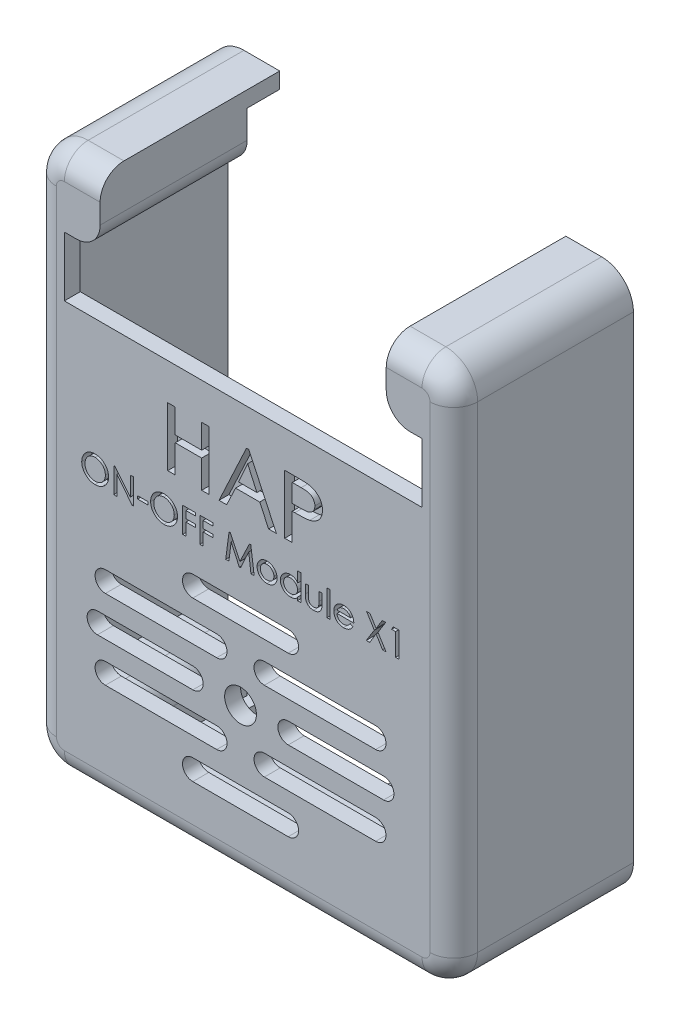
from build123d import *

# Parameters (mm, degrees)
ESBO_O1_W                = 53
ESBO_O1_H                = 68
RESSALTO_EXTRUS_O1_DEPTH = 22.6
FILETE1_R                = 4
FILETE2_R                = 3
CASCA1_T                 = -2
RESSALTO_EXTRUS_O2_DEPTH = 16.5
ESBO_O4_R                = 1
CORTE_EXTRUS_O1_DEPTH    = 6
CORTE_EXTRUS_O2_DEPTH    = 49.672476822
ESBO_O6_W                = 17
ESBO_O6_H                = 2
CORTE_EXTRUS_O3_DEPTH    = 6
RESSALTO_EXTRUS_O3_DEPTH = 4.5
ESBO_O8_W                = 21
ESBO_O8_H                = 8
RESSALTO_EXTRUS_O4_DEPTH = 1.5
FILETE3_R                = 1
ESBO_O11_W               = 1.302564103
ESBO_O11_H               = 0.366346154
ESBO_O11_W_2             = 0.407051282
ESBO_O11_H_2             = 3.256410256
CORTE_EXTRUS_O5_DEPTH    = 1.25
ESBO_O15_R               = 2
CORTE_EXTRUS_O6_DEPTH    = 54.037816697
CORTE_EXTRUS_O7_DEPTH    = 54.037816697
CORTE_EXTRUS_O8_DEPTH    = 54.037816697


with BuildPart() as part:
    # Esboço1 → Ressalto-extrusão1 (new body)
    with BuildSketch(Plane.XY):
        Rectangle(ESBO_O1_W, ESBO_O1_H)
    extrude(amount=RESSALTO_EXTRUS_O1_DEPTH)

    # Filete1
    filete1_edges = [part.edges().sort_by_distance(p)[0] for p in [
        (-26.5, -34, 11.3),
        (26.5, -34, 11.3),
        (-26.5, 34, 11.3),
        (26.5, 34, 11.3),
    ]]
    fillet(filete1_edges, radius=FILETE1_R)

    # Filete2
    filete2_edges = [part.edges().sort_by_distance(p)[0] for p in [
        (0, 34, 22.6),
        (26.5, 0, 22.6),
        (25.328427125, -32.828427125, 22.6),
        (0, -34, 22.6),
        (-25.328427125, -32.828427125, 22.6),
        (-26.5, 0, 22.6),
        (-25.328427125, 32.828427125, 22.6),
        (25.328427125, 32.828427125, 22.6),
    ]]
    fillet(filete2_edges, radius=FILETE2_R)

    # Casca1
    casca1_openings = [part.faces().sort_by_distance(p)[0] for p in [
        (0, 0, 0),
    ]]
    offset(amount=CASCA1_T, openings=casca1_openings, kind=Kind.INTERSECTION)

    # Esboço3 → Ressalto-extrusão2 (add)
    with BuildSketch(Plane(origin=(0, 0, 20.6), x_dir=(-1, 0, 0), z_dir=(0, 0, -1))):
        with BuildLine():
            Line((-18, -28.5), (-18, -32))
            Line((-18, -32), (-22.5, -32))
            ThreePointArc((-22.5, -32), (-23.914213562, -31.414213562), (-24.5, -30))
            Line((-24.5, -30), (-24.5, -25.5))
            Line((-24.5, -25.5), (-21, -25.5))
            ThreePointArc((-21, -25.5), (-18.878679656, -26.378679656), (-18, -28.5))
        make_face()
        with BuildLine():
            Line((22.5, -32), (18, -32))
            Line((18, -32), (18, -28.5))
            ThreePointArc((18, -28.5), (18.878679656, -26.378679656), (21, -25.5))
            Line((21, -25.5), (24.5, -25.5))
            Line((24.5, -25.5), (24.5, -30))
            ThreePointArc((24.5, -30), (23.914213562, -31.414213562), (22.5, -32))
        make_face()
        with BuildLine():
            Line((18, 28.5), (18, 32))
            Line((18, 32), (22.5, 32))
            ThreePointArc((22.5, 32), (23.914213562, 31.414213562), (24.5, 30))
            Line((24.5, 30), (24.5, 25.5))
            Line((24.5, 25.5), (21, 25.5))
            ThreePointArc((21, 25.5), (18.878679656, 26.378679656), (18, 28.5))
        make_face()
        with BuildLine():
            Line((-22.5, 32), (-18, 32))
            Line((-18, 32), (-18, 28.5))
            ThreePointArc((-18, 28.5), (-18.878679656, 26.378679656), (-21, 25.5))
            Line((-21, 25.5), (-24.5, 25.5))
            Line((-24.5, 25.5), (-24.5, 30))
            ThreePointArc((-24.5, 30), (-23.914213562, 31.414213562), (-22.5, 32))
        make_face()
    extrude(amount=RESSALTO_EXTRUS_O2_DEPTH)

    # Esboço4 → Corte-extrusão1 (cut)
    with BuildSketch(Plane(origin=(0, 0, 4.1), x_dir=(-1, 0, 0), z_dir=(0, 0, -1))):
        with Locations((-21, -28.5)):
            Circle(ESBO_O4_R)
        with Locations((21, -28.5)):
            Circle(ESBO_O4_R)
        with Locations((-21, 28.5)):
            Circle(ESBO_O4_R)
        with Locations((21, 28.5)):
            Circle(ESBO_O4_R)
    extrude(amount=-CORTE_EXTRUS_O1_DEPTH, mode=Mode.SUBTRACT)

    # Esboço5 → Corte-extrusão2 (cut, through all)
    with BuildSketch(Plane.XY.offset(22.6)):
        with BuildLine():
            Line((-18, 34), (18, 34))
            Line((18, 34), (18, 28.5))
            ThreePointArc((18, 28.5), (18.878679656, 26.378679656), (21, 25.5))
            Line((21, 25.5), (22.5, 25.5))
            Line((22.5, 25.5), (22.5, 18))
            Line((22.5, 18), (-22.5, 18))
            Line((-22.5, 18), (-22.5, 25.5))
            Line((-22.5, 25.5), (-21, 25.5))
            ThreePointArc((-21, 25.5), (-18.878679656, 26.378679656), (-18, 28.5))
            Line((-18, 28.5), (-18, 34))
        make_face()
    extrude(amount=-CORTE_EXTRUS_O2_DEPTH, mode=Mode.SUBTRACT)

    # Esboço6 → Corte-extrusão3 (cut)
    with BuildSketch(Plane(origin=(0, 0, 0), x_dir=(-1, 0, 0), z_dir=(0, 0, -1))):
        with Locations((8, -33)):
            Rectangle(ESBO_O6_W, ESBO_O6_H)
    extrude(amount=-CORTE_EXTRUS_O3_DEPTH, mode=Mode.SUBTRACT)

    # Esboço7 → Ressalto-extrusão3 (add)
    with BuildSketch(Plane.XZ.offset(34)):
        Polygon((-16.5, 0), (-18.5, 0), (-18.5, 8), (2.5, 8), (2.5, 0), (0.5, 0), (0.5, 6), (-16.5, 6), align=None)
    extrude(amount=RESSALTO_EXTRUS_O3_DEPTH)

    # Esboço8 → Ressalto-extrusão4 (add)
    with BuildSketch(Plane.XZ.offset(38.5)):
        with Locations((-8, 4)):
            Rectangle(ESBO_O8_W, ESBO_O8_H)
    extrude(amount=RESSALTO_EXTRUS_O4_DEPTH)

    # Filete3
    filete3_edges = [part.edges().sort_by_distance(p)[0] for p in [
        (-18.5, -37, 8),
        (-8, -40, 8),
        (2.5, -37, 8),
        (2.5, -34, 4),
        (-18.5, -34, 4),
        (-8, -34, 8),
        (2.5, -40, 4),
        (-18.5, -40, 4),
    ]]
    fillet(filete3_edges, radius=FILETE3_R)

    # Esboço11 → Corte-extrusão5 (cut)
    # profile 1 of 17: a face of its own
    with BuildSketch(Plane.XY.offset(22.6)):
        Polygon((-9.497863248, 13.408333333), (-8.548076923, 13.408333333), (-8.548076923, 10.369017094), (-5.223824786, 10.369017094), (-5.223824786, 13.408333333), (-4.274038462, 13.408333333), (-4.274038462, 6), (-5.223824786, 6), (-5.223824786, 9.514209402), (-8.548076923, 9.514209402), (-8.548076923, 6), (-9.497863248, 6), align=None)
    # profile 2 of 17: a face of its own
    with BuildSketch(Plane.XY.offset(22.6)):
        Polygon((0.712339744, 13.408333333), (4.179059829, 6), (3.204044805, 6), (2.079141627, 8.374465812), (-0.951270366, 8.374465812), (-2.076173544, 6), (-3.039316239, 6), (0.415531517, 13.408333333), align=None)
        Polygon((0.56393563, 11.789244458), (-0.58916433, 9.229273504), (1.728907919, 9.229273504), align=None, mode=Mode.SUBTRACT)
    # profile 3 of 17: a face of its own
    with BuildSketch(Plane.XY.offset(22.6)):
        with BuildLine():
            Line((5.223824786, 13.408333333), (6.741998865, 13.408333333))
            add(Edge.make_bspline(
                [(6.741998865, 13.408333333), (6.842424822, 13.408278623), (7.034886838, 13.408173773), (7.310897954, 13.401068802), (7.561302187, 13.394936623), (7.786469526, 13.383150051), (7.985887317, 13.367004707), (8.159627149, 13.348019716), (8.307875568, 13.326666846), (8.397280983, 13.307362149), (8.438257879, 13.29851429)],
                knots=[0, 0, 0, 0, 1.415450773, 2.712650385, 3.891531898, 4.945867971, 5.890285756, 6.71109784, 7.409261617, 8, 8, 8, 8], degree=3))
            add(Edge.make_bspline(
                [(8.438257879, 13.29851429), (8.495942574, 13.283680344), (8.609736796, 13.254417517), (8.772409869, 13.194098175), (8.926764641, 13.125557678), (9.072274115, 13.047590545), (9.207451971, 12.957542686), (9.335214601, 12.859707097), (9.451632221, 12.749135392), (9.560693201, 12.63119165), (9.656383934, 12.503181942), (9.742123106, 12.36943773), (9.81318784, 12.228016417), (9.871591028, 12.079444043), (9.917246912, 11.924495232), (9.950087848, 11.762676295), (9.969821611, 11.594342074), (9.971766058, 11.479628522), (9.97275641, 11.421202257)],
                knots=[0, 0, 0, 0, 1.085641105, 2.141637125, 3.15936318, 4.164535163, 5.147931294, 6.118832473, 7.09541784, 8.072503165, 9.045079613, 10.006206652, 10.966486436, 11.926469503, 12.914201526, 13.908586125, 14.934794539, 16, 16, 16, 16], degree=3))
            add(Edge.make_bspline(
                [(9.97275641, 11.421202257), (9.971744331, 11.362778714), (9.969748707, 11.24757889), (9.950139559, 11.078238345), (9.917268861, 10.916083249), (9.872953033, 10.760397252), (9.814712204, 10.612148591), (9.745119235, 10.470085699), (9.66099468, 10.335818116), (9.564956582, 10.208413881), (9.456502164, 10.089830924), (9.33720323, 9.980519339), (9.205491635, 9.882388209), (9.062718232, 9.793676181), (8.909380518, 9.712827643), (8.743935903, 9.643289027), (8.567122515, 9.584035503), (8.444410034, 9.552528781), (8.381864316, 9.536470019)],
                knots=[0, 0, 0, 0, 1.042501879, 2.055610221, 3.037454288, 3.993184118, 4.940927036, 5.876790881, 6.812738028, 7.76458517, 8.720845088, 9.677105007, 10.648370915, 11.647960469, 12.67482723, 13.739162042, 14.847666245, 16, 16, 16, 16], degree=3))
            add(Edge.make_bspline(
                [(8.381864316, 9.536470019), (8.335960628, 9.526517768), (8.235822679, 9.50480714), (8.069649778, 9.482215677), (7.876024426, 9.463707416), (7.65433466, 9.447604886), (7.405489181, 9.434078617), (7.128384218, 9.426026753), (6.823651765, 9.419529496), (6.610912827, 9.41933308), (6.50010016, 9.419230769)],
                knots=[0, 0, 0, 0, 0.596754895, 1.30180848, 2.129432098, 3.068723067, 4.126429569, 5.296393252, 6.591729958, 8, 8, 8, 8], degree=3))
            Line((6.50010016, 9.419230769), (6.173611111, 9.419230769))
            Line((6.173611111, 9.419230769), (6.173611111, 6))
            Line((6.173611111, 6), (5.223824786, 6))
            Line((5.223824786, 6), (5.223824786, 13.408333333))
        make_face()
        with BuildLine():
            Line((6.173611111, 12.553525641), (6.173611111, 10.271070379))
            Line((6.173611111, 10.271070379), (7.242120726, 10.25919805))
            add(Edge.make_bspline(
                [(7.242120726, 10.25919805), (7.302473989, 10.259993888), (7.418755721, 10.261527217), (7.586559348, 10.266851114), (7.740903047, 10.277671577), (7.882084959, 10.290291281), (8.01039029, 10.307984164), (8.125241418, 10.33006574), (8.227617647, 10.354875585), (8.344686321, 10.393882154), (8.475726415, 10.454787823), (8.61503635, 10.547717277), (8.737833254, 10.658854056), (8.839244978, 10.789661827), (8.920856934, 10.933786251), (8.98152116, 11.087828654), (9.015858204, 11.251503707), (9.020579374, 11.36317167), (9.022970085, 11.419718216)],
                knots=[0, 0, 0, 0, 1.196816259, 2.305888068, 3.328295896, 4.264290022, 5.116006351, 5.89509982, 6.582615619, 7.202969204, 8.339503699, 9.435837163, 10.511976311, 11.608836183, 12.702577786, 13.786378287, 14.879063815, 16, 16, 16, 16], degree=3))
            add(Edge.make_bspline(
                [(9.022970085, 11.419718216), (9.020562105, 11.474291432), (9.015785966, 11.582535354), (8.981269433, 11.741734618), (8.920577209, 11.89274005), (8.838832324, 12.03483991), (8.739496932, 12.164721312), (8.621829434, 12.276451432), (8.488662399, 12.367766063), (8.364340726, 12.426251471), (8.253488827, 12.464312692), (8.155788815, 12.486671003), (8.045417653, 12.507575713), (7.921689966, 12.52549693), (7.784490646, 12.538422006), (7.633985082, 12.546712743), (7.470718887, 12.553209836), (7.357388702, 12.553417672), (7.29851429, 12.553525641)],
                knots=[0, 0, 0, 0, 1.113934591, 2.209447376, 3.306634974, 4.424089692, 5.547326231, 6.633252657, 7.723023745, 8.829884498, 9.427152571, 10.113060991, 10.873719268, 11.720735618, 12.664423995, 13.686322671, 14.798057257, 16, 16, 16, 16], degree=3))
            Line((7.29851429, 12.553525641), (6.173611111, 12.553525641))
        make_face(mode=Mode.SUBTRACT)
    # profile 4 of 17: a face of its own
    with BuildSketch(Plane.XY.offset(22.6)):
        with BuildLine():
            add(Edge.make_bspline(
                [(-18.662665264, 3.256410256), (-18.601744117, 3.255003803), (-18.482002384, 3.25223939), (-18.306342018, 3.228669906), (-18.138591903, 3.19096362), (-17.97899947, 3.137105594), (-17.827456977, 3.068097153), (-17.683725345, 2.983805674), (-17.548231396, 2.883975806), (-17.422631712, 2.769887276), (-17.308539955, 2.645610402), (-17.20743021, 2.514241641), (-17.123469959, 2.37519935), (-17.053283392, 2.230495554), (-17.000175872, 2.078787824), (-16.96082889, 1.921361518), (-16.937623022, 1.757161996), (-16.934777204, 1.645450591), (-16.933333333, 1.588772035)],
                knots=[0, 0, 0, 0, 1.090651108, 2.14369656, 3.167927427, 4.165692988, 5.154576575, 6.145033357, 7.14440862, 8.163220312, 9.178978109, 10.162394332, 11.12677451, 12.082874982, 13.037579715, 13.999894772, 14.985214855, 16, 16, 16, 16], degree=3))
            add(Edge.make_bspline(
                [(-16.933333333, 1.588772035), (-16.934749442, 1.532510339), (-16.937540326, 1.42162915), (-16.961192075, 1.2584302), (-16.999322574, 1.101194651), (-17.052721478, 0.949616309), (-17.122770743, 0.80485136), (-17.20715091, 0.665685237), (-17.307652338, 0.533447238), (-17.421318353, 0.408300417), (-17.546229622, 0.293802288), (-17.680351207, 0.193247278), (-17.822056211, 0.10861202), (-17.970638705, 0.038157045), (-18.127314155, -0.014738461), (-18.290912715, -0.053962692), (-18.462078359, -0.077137407), (-18.578640865, -0.079970765), (-18.637860577, -0.081410256)],
                knots=[0, 0, 0, 0, 1.015667565, 2.001689161, 2.971180881, 3.933912672, 4.898051938, 5.870540525, 6.8683264, 7.892867857, 8.919988739, 9.923897136, 10.914753654, 11.896185405, 12.887840524, 13.895451133, 14.930781579, 16, 16, 16, 16], degree=3))
            add(Edge.make_bspline(
                [(-18.637860577, -0.081410256), (-18.695608506, -0.08001429), (-18.809239239, -0.077267443), (-18.975937346, -0.053473597), (-19.135870235, -0.016380647), (-19.288831264, 0.036928962), (-19.435063394, 0.104924402), (-19.573733498, 0.189271151), (-19.706066842, 0.287509193), (-19.829546275, 0.400049536), (-19.942238019, 0.523287882), (-20.041085816, 0.654470412), (-20.125156425, 0.791928327), (-20.193546393, 0.93581885), (-20.246824366, 1.086278638), (-20.283783736, 1.243271526), (-20.307710291, 1.406350047), (-20.310462493, 1.517240975), (-20.311858974, 1.573507612)],
                knots=[0, 0, 0, 0, 1.056734814, 2.079339537, 3.076314658, 4.058285941, 5.039336339, 6.023146808, 7.024524339, 8.052147497, 9.076900738, 10.077495695, 11.054668894, 12.021676166, 12.988994953, 13.970866516, 14.970407042, 16, 16, 16, 16], degree=3))
            add(Edge.make_bspline(
                [(-20.311858974, 1.573507612), (-20.31137443, 1.611274565), (-20.310411454, 1.686332022), (-20.298800992, 1.797787022), (-20.281987499, 1.907461708), (-20.257764583, 2.014986983), (-20.226520877, 2.120381981), (-20.188011654, 2.223425281), (-20.143904677, 2.324987804), (-20.091295619, 2.423053547), (-20.034176915, 2.518192023), (-19.970705614, 2.607848), (-19.903567029, 2.693113205), (-19.829934386, 2.771711496), (-19.752269598, 2.845947091), (-19.669303364, 2.914674489), (-19.581544442, 2.97851468), (-19.488614538, 3.036045974), (-19.392803683, 3.088078907), (-19.294036889, 3.132730157), (-19.193655571, 3.17105337), (-19.091189569, 3.20211469), (-18.986910983, 3.226636608), (-18.880592221, 3.243334708), (-18.772317985, 3.254968196), (-18.699373431, 3.255927501), (-18.662665264, 3.256410256)],
                knots=[0, 0, 0, 0, 1.036913812, 2.060746492, 3.074578145, 4.08324605, 5.085523353, 6.091481477, 7.103103322, 8.124200051, 9.145827961, 10.149052085, 11.139400635, 12.124186929, 13.104469564, 14.088618662, 15.081002312, 16.082788945, 17.088477375, 18.073521874, 19.057670972, 20.037642247, 21.012252997, 21.997331918, 22.992189685, 24, 24, 24, 24], degree=3))
        make_face()
        with BuildLine():
            add(Edge.make_bspline(
                [(-18.649308894, 2.890064103), (-18.676045291, 2.889640879), (-18.72922458, 2.888799077), (-18.808447527, 2.879987574), (-18.886850107, 2.866751425), (-18.964568121, 2.848136194), (-19.041665645, 2.824876076), (-19.117479086, 2.795119858), (-19.19274096, 2.761073605), (-19.266108793, 2.720716006), (-19.337630188, 2.676907928), (-19.405278934, 2.628002028), (-19.469831428, 2.57601705), (-19.530357427, 2.519201621), (-19.586743296, 2.458299566), (-19.639302158, 2.393411059), (-19.688435171, 2.324760531), (-19.733066402, 2.251872138), (-19.774288363, 2.176254421), (-19.808987955, 2.09741784), (-19.838381082, 2.016201204), (-19.862504966, 1.932690025), (-19.881833082, 1.846719095), (-19.894764667, 1.758256544), (-19.903604107, 1.667393823), (-19.904402399, 1.605966367), (-19.904807692, 1.574779647)],
                knots=[0, 0, 0, 0, 0.951425037, 1.892405618, 2.834142553, 3.780555396, 4.735506122, 5.698386817, 6.677778342, 7.674036042, 8.677244726, 9.661625187, 10.643485342, 11.625954439, 12.613944774, 13.595804929, 14.596853729, 15.616869823, 16.636634596, 17.660413109, 18.67984269, 19.709280547, 20.753005387, 21.813969624, 22.890152378, 24, 24, 24, 24], degree=3))
            add(Edge.make_bspline(
                [(-19.904807692, 1.574779647), (-19.903823176, 1.529345534), (-19.901892187, 1.440232945), (-19.88326967, 1.309522063), (-19.854398364, 1.184618348), (-19.813532374, 1.065648211), (-19.76091307, 0.952647655), (-19.696511037, 0.84564932), (-19.620218316, 0.744385092), (-19.53294509, 0.650800902), (-19.438332173, 0.565290942), (-19.337976086, 0.490778533), (-19.234174434, 0.426346025), (-19.125261371, 0.374701394), (-19.012304459, 0.334453921), (-18.895111932, 0.305815049), (-18.773662147, 0.288108006), (-18.691134436, 0.286002819), (-18.649308894, 0.284935897)],
                knots=[0, 0, 0, 0, 1.087324682, 2.132633634, 3.154656843, 4.153212625, 5.138884617, 6.133989092, 7.13811672, 8.169089965, 9.193543553, 10.187520856, 11.158295186, 12.114249704, 13.068004623, 14.02467326, 14.998892505, 16, 16, 16, 16], degree=3))
            add(Edge.make_bspline(
                [(-18.649308894, 0.284935897), (-18.619607662, 0.285360236), (-18.560723002, 0.286201516), (-18.473432999, 0.294890097), (-18.387870147, 0.308286725), (-18.303984031, 0.326320824), (-18.222024394, 0.351193458), (-18.141372747, 0.379807829), (-18.062914368, 0.415492998), (-17.986085632, 0.45497111), (-17.912847897, 0.500372971), (-17.842375799, 0.54863828), (-17.776093457, 0.601154922), (-17.715272161, 0.658972845), (-17.657432349, 0.719472901), (-17.604143961, 0.784352614), (-17.555034344, 0.853188421), (-17.510596075, 0.92575989), (-17.470736586, 1.001197722), (-17.435308403, 1.07894241), (-17.406512684, 1.159108639), (-17.381803014, 1.240912277), (-17.363584397, 1.325188184), (-17.350410936, 1.411426466), (-17.341616432, 1.499760419), (-17.340798567, 1.559281954), (-17.340384615, 1.589408053)],
                knots=[0, 0, 0, 0, 1.036970321, 2.055862331, 3.060095599, 4.060719653, 5.049301004, 6.049377071, 7.046955997, 8.056986028, 9.063944937, 10.053856218, 11.039021426, 12.013303897, 12.982198174, 13.960523328, 14.942567566, 15.933032457, 16.929951754, 17.920776327, 18.913894254, 19.902475604, 20.903099658, 21.921964767, 22.948227815, 24, 24, 24, 24], degree=3))
            add(Edge.make_bspline(
                [(-17.340384615, 1.589408053), (-17.340800464, 1.619322095), (-17.341622016, 1.678420374), (-17.350366756, 1.765913739), (-17.363568962, 1.851096609), (-17.38191567, 1.934278004), (-17.406387591, 2.015093486), (-17.435331492, 2.094161583), (-17.470738373, 2.170641126), (-17.510620479, 2.2447951), (-17.555145139, 2.316403237), (-17.604824465, 2.384122233), (-17.658293266, 2.448735291), (-17.716343497, 2.509290339), (-17.779013444, 2.566008044), (-17.845707949, 2.619313216), (-17.916627764, 2.669411278), (-17.991948202, 2.714527917), (-18.069657951, 2.75598252), (-18.149343623, 2.791334532), (-18.229627047, 2.822274525), (-18.31124847, 2.847130511), (-18.394192431, 2.866082568), (-18.478252988, 2.880222203), (-18.563481287, 2.888721909), (-18.620669289, 2.889616229), (-18.649308894, 2.890064103)],
                knots=[0, 0, 0, 0, 1.048789873, 2.071992723, 3.080474812, 4.070813472, 5.056451928, 6.039816187, 7.021295338, 8.009314668, 8.991328769, 9.975844821, 10.952581135, 11.930703152, 12.91499457, 13.914777939, 14.923479275, 15.957618598, 16.991998452, 18.010408503, 19.012925223, 20.00783076, 20.999814803, 21.994803685, 22.995802798, 24, 24, 24, 24], degree=3))
        make_face(mode=Mode.SUBTRACT)
    # profile 5 of 17: a face of its own
    with BuildSketch(Plane.XY.offset(22.6)):
        Polygon((-16.282051282, 0), (-16.282051282, 3.175), (-16.131315104, 3.175), (-14.206089744, 0.762585136), (-14.206089744, 3.175), (-13.799038462, 3.175), (-13.799038462, 0), (-13.96567508, 0), (-15.875, 2.406054687), (-15.875, 0), align=None)
    # profile 6 of 17: a face of its own
    with BuildSketch(Plane.XY.offset(22.6)):
        with Locations((-12.618589743, 1.200801282)):
            Rectangle(ESBO_O11_W, ESBO_O11_H)
    # profile 7 of 17: a face of its own
    with BuildSketch(Plane.XY.offset(22.6)):
        with BuildLine():
            add(Edge.make_bspline(
                [(-9.992472957, 3.256410256), (-9.931551809, 3.255003803), (-9.811810076, 3.25223939), (-9.63614971, 3.228669906), (-9.468399595, 3.19096362), (-9.308807162, 3.137105594), (-9.157264669, 3.068097153), (-9.013533038, 2.983805674), (-8.878039088, 2.883975806), (-8.752439404, 2.769887276), (-8.638347648, 2.645610402), (-8.537237903, 2.514241641), (-8.453277651, 2.37519935), (-8.383091084, 2.230495554), (-8.329983564, 2.078787824), (-8.290636583, 1.921361518), (-8.267430714, 1.757161996), (-8.264584896, 1.645450591), (-8.263141026, 1.588772035)],
                knots=[0, 0, 0, 0, 1.090651108, 2.14369656, 3.167927427, 4.165692988, 5.154576575, 6.145033357, 7.14440862, 8.163220312, 9.178978109, 10.162394332, 11.12677451, 12.082874982, 13.037579715, 13.999894772, 14.985214855, 16, 16, 16, 16], degree=3))
            add(Edge.make_bspline(
                [(-8.263141026, 1.588772035), (-8.264557135, 1.532510339), (-8.267348019, 1.42162915), (-8.290999767, 1.2584302), (-8.329130267, 1.101194651), (-8.38252917, 0.949616309), (-8.452578435, 0.80485136), (-8.536958602, 0.665685237), (-8.63746003, 0.533447238), (-8.751126045, 0.408300417), (-8.876037314, 0.293802288), (-9.0101589, 0.193247278), (-9.151863904, 0.10861202), (-9.300446397, 0.038157045), (-9.457121847, -0.014738461), (-9.620720407, -0.053962692), (-9.791886052, -0.077137407), (-9.908448557, -0.079970765), (-9.967668269, -0.081410256)],
                knots=[0, 0, 0, 0, 1.015667565, 2.001689161, 2.971180881, 3.933912672, 4.898051938, 5.870540525, 6.8683264, 7.892867857, 8.919988739, 9.923897136, 10.914753654, 11.896185405, 12.887840524, 13.895451133, 14.930781579, 16, 16, 16, 16], degree=3))
            add(Edge.make_bspline(
                [(-9.967668269, -0.081410256), (-10.025416198, -0.08001429), (-10.139046931, -0.077267443), (-10.305745038, -0.053473597), (-10.465677927, -0.016380647), (-10.618638956, 0.036928962), (-10.764871086, 0.104924402), (-10.90354119, 0.189271151), (-11.035874534, 0.287509193), (-11.159353967, 0.400049536), (-11.272045712, 0.523287882), (-11.370893509, 0.654470412), (-11.454964117, 0.791928327), (-11.523354085, 0.93581885), (-11.576632059, 1.086278638), (-11.613591428, 1.243271526), (-11.637517983, 1.406350047), (-11.640270185, 1.517240975), (-11.641666667, 1.573507612)],
                knots=[0, 0, 0, 0, 1.056734814, 2.079339537, 3.076314658, 4.058285941, 5.039336339, 6.023146808, 7.024524339, 8.052147497, 9.076900738, 10.077495695, 11.054668894, 12.021676166, 12.988994953, 13.970866516, 14.970407042, 16, 16, 16, 16], degree=3))
            add(Edge.make_bspline(
                [(-11.641666667, 1.573507612), (-11.641182122, 1.611274565), (-11.640219147, 1.686332022), (-11.628608685, 1.797787022), (-11.611795191, 1.907461708), (-11.587572275, 2.014986983), (-11.556328569, 2.120381981), (-11.517819347, 2.223425281), (-11.47371237, 2.324987804), (-11.421103311, 2.423053547), (-11.363984607, 2.518192023), (-11.300513306, 2.607848), (-11.233374721, 2.693113205), (-11.159742078, 2.771711496), (-11.08207729, 2.845947091), (-10.999111057, 2.914674489), (-10.911352134, 2.97851468), (-10.81842223, 3.036045974), (-10.722611375, 3.088078907), (-10.623844581, 3.132730157), (-10.523463264, 3.17105337), (-10.420997261, 3.20211469), (-10.316718675, 3.226636608), (-10.210399914, 3.243334708), (-10.102125677, 3.254968196), (-10.029181123, 3.255927501), (-9.992472957, 3.256410256)],
                knots=[0, 0, 0, 0, 1.036913812, 2.060746492, 3.074578145, 4.08324605, 5.085523353, 6.091481477, 7.103103322, 8.124200051, 9.145827961, 10.149052085, 11.139400635, 12.124186929, 13.104469564, 14.088618662, 15.081002312, 16.082788945, 17.088477375, 18.073521874, 19.057670972, 20.037642247, 21.012252997, 21.997331918, 22.992189685, 24, 24, 24, 24], degree=3))
        make_face()
        with BuildLine():
            add(Edge.make_bspline(
                [(-9.979116587, 2.890064103), (-10.005852983, 2.889640879), (-10.059032273, 2.888799077), (-10.138255219, 2.879987574), (-10.216657799, 2.866751425), (-10.294375813, 2.848136194), (-10.371473337, 2.824876076), (-10.447286779, 2.795119858), (-10.522548652, 2.761073605), (-10.595916486, 2.720716006), (-10.667437881, 2.676907928), (-10.735086626, 2.628002028), (-10.79963912, 2.57601705), (-10.860165119, 2.519201621), (-10.916550989, 2.458299566), (-10.96910985, 2.393411059), (-11.018242863, 2.324760531), (-11.062874094, 2.251872138), (-11.104096055, 2.176254421), (-11.138795648, 2.09741784), (-11.168188775, 2.016201204), (-11.192312658, 1.932690025), (-11.211640774, 1.846719095), (-11.224572359, 1.758256544), (-11.233411799, 1.667393823), (-11.234210092, 1.605966367), (-11.234615385, 1.574779647)],
                knots=[0, 0, 0, 0, 0.951425037, 1.892405618, 2.834142553, 3.780555396, 4.735506122, 5.698386817, 6.677778342, 7.674036042, 8.677244726, 9.661625187, 10.643485342, 11.625954439, 12.613944774, 13.595804929, 14.596853729, 15.616869823, 16.636634596, 17.660413109, 18.67984269, 19.709280547, 20.753005387, 21.813969624, 22.890152378, 24, 24, 24, 24], degree=3))
            add(Edge.make_bspline(
                [(-11.234615385, 1.574779647), (-11.233630869, 1.529345534), (-11.231699879, 1.440232945), (-11.213077363, 1.309522063), (-11.184206057, 1.184618348), (-11.143340066, 1.065648211), (-11.090720762, 0.952647655), (-11.026318729, 0.84564932), (-10.950026008, 0.744385092), (-10.862752783, 0.650800902), (-10.768139866, 0.565290942), (-10.667783778, 0.490778533), (-10.563982126, 0.426346025), (-10.455069064, 0.374701394), (-10.342112151, 0.334453921), (-10.224919625, 0.305815049), (-10.103469839, 0.288108006), (-10.020942128, 0.286002819), (-9.979116587, 0.284935897)],
                knots=[0, 0, 0, 0, 1.087324682, 2.132633634, 3.154656843, 4.153212625, 5.138884617, 6.133989092, 7.13811672, 8.169089965, 9.193543553, 10.187520856, 11.158295186, 12.114249704, 13.068004623, 14.02467326, 14.998892505, 16, 16, 16, 16], degree=3))
            add(Edge.make_bspline(
                [(-9.979116587, 0.284935897), (-9.949415354, 0.285360236), (-9.890530694, 0.286201516), (-9.803240692, 0.294890097), (-9.717677839, 0.308286725), (-9.633791723, 0.326320824), (-9.551832087, 0.351193458), (-9.471180439, 0.379807829), (-9.392722061, 0.415492998), (-9.315893324, 0.45497111), (-9.24265559, 0.500372971), (-9.172183491, 0.54863828), (-9.10590115, 0.601154922), (-9.045079854, 0.658972845), (-8.987240041, 0.719472901), (-8.933951654, 0.784352614), (-8.884842037, 0.853188421), (-8.840403768, 0.92575989), (-8.800544278, 1.001197722), (-8.765116095, 1.07894241), (-8.736320376, 1.159108639), (-8.711610707, 1.240912277), (-8.693392089, 1.325188184), (-8.680218629, 1.411426466), (-8.671424124, 1.499760419), (-8.67060626, 1.559281954), (-8.670192308, 1.589408053)],
                knots=[0, 0, 0, 0, 1.036970321, 2.055862331, 3.060095599, 4.060719653, 5.049301004, 6.049377071, 7.046955997, 8.056986028, 9.063944937, 10.053856218, 11.039021426, 12.013303897, 12.982198174, 13.960523328, 14.942567566, 15.933032457, 16.929951754, 17.920776327, 18.913894254, 19.902475604, 20.903099658, 21.921964767, 22.948227815, 24, 24, 24, 24], degree=3))
            add(Edge.make_bspline(
                [(-8.670192308, 1.589408053), (-8.670608156, 1.619322095), (-8.671429709, 1.678420374), (-8.680174448, 1.765913739), (-8.693376655, 1.851096609), (-8.711723363, 1.934278004), (-8.736195283, 2.015093486), (-8.765139184, 2.094161583), (-8.800546066, 2.170641126), (-8.840428171, 2.2447951), (-8.884952831, 2.316403237), (-8.934632157, 2.384122233), (-8.988100958, 2.448735291), (-9.04615119, 2.509290339), (-9.108821136, 2.566008044), (-9.175515642, 2.619313216), (-9.246435456, 2.669411278), (-9.321755895, 2.714527917), (-9.399465644, 2.75598252), (-9.479151315, 2.791334532), (-9.559434739, 2.822274525), (-9.641056162, 2.847130511), (-9.724000124, 2.866082568), (-9.80806068, 2.880222203), (-9.893288979, 2.888721909), (-9.950476981, 2.889616229), (-9.979116587, 2.890064103)],
                knots=[0, 0, 0, 0, 1.048789873, 2.071992723, 3.080474812, 4.070813472, 5.056451928, 6.039816187, 7.021295338, 8.009314668, 8.991328769, 9.975844821, 10.952581135, 11.930703152, 12.91499457, 13.914777939, 14.923479275, 15.957618598, 16.991998452, 18.010408503, 19.012925223, 20.00783076, 20.999814803, 21.994803685, 22.995802798, 24, 24, 24, 24], degree=3))
        make_face(mode=Mode.SUBTRACT)
    # profile 8 of 17: a face of its own
    with BuildSketch(Plane.XY.offset(22.6)):
        Polygon((-7.611858974, 3.175), (-5.983653846, 3.175), (-5.983653846, 2.808653846), (-7.204807692, 2.808653846), (-7.204807692, 1.913141026), (-5.983653846, 1.913141026), (-5.983653846, 1.546794872), (-7.204807692, 1.546794872), (-7.204807692, 0), (-7.611858974, 0), align=None)
    # profile 9 of 17: a face of its own
    with BuildSketch(Plane.XY.offset(22.6)):
        Polygon((-5.454487179, 3.175), (-3.826282051, 3.175), (-3.826282051, 2.808653846), (-5.047435897, 2.808653846), (-5.047435897, 1.913141026), (-3.826282051, 1.913141026), (-3.826282051, 1.546794872), (-5.047435897, 1.546794872), (-5.047435897, 0), (-5.454487179, 0), align=None)
    # profile 10 of 17: a face of its own
    with BuildSketch(Plane.XY.offset(22.6)):
        Polygon((-2.198076923, 0), (-1.773853165, 3.175), (-1.613576723, 3.175), (-0.409595353, 0.651282051), (0.794386018, 3.175), (0.95720653, 3.175), (1.383974359, 0), (0.980103165, 0), (0.697711338, 2.238782051), (-0.33263722, 0), (-0.486553486, 0), (-1.513721955, 2.238782051), (-1.794841747, 0), align=None)
    # profile 11 of 17: a face of its own
    with BuildSketch(Plane.XY.offset(22.6)):
        with BuildLine():
            add(Edge.make_bspline(
                [(2.993098958, 2.401602564), (3.040215907, 2.400312272), (3.132461998, 2.397786125), (3.267442352, 2.380013481), (3.395619907, 2.349134112), (3.51736203, 2.306870062), (3.63216769, 2.251498262), (3.740323634, 2.184507946), (3.841443174, 2.104596516), (3.902353802, 2.043322575), (3.933133013, 2.012359776)],
                knots=[0, 0, 0, 0, 1.078775739, 2.112039281, 3.110494877, 4.093081892, 5.057110616, 6.022958758, 7.000966324, 8, 8, 8, 8], degree=3))
            add(Edge.make_bspline(
                [(3.933133013, 2.012359776), (3.960427909, 1.981670159), (4.014091803, 1.92133198), (4.083431366, 1.824003633), (4.142482509, 1.723882977), (4.190256469, 1.6202152), (4.228335767, 1.513474356), (4.254744035, 1.403238674), (4.271373968, 1.2897167), (4.273143099, 1.212943641), (4.274038462, 1.174088542)],
                knots=[0, 0, 0, 0, 1.062178036, 2.088324843, 3.086640365, 4.066023852, 5.037709567, 6.014384934, 6.995073642, 8, 8, 8, 8], degree=3))
            add(Edge.make_bspline(
                [(4.274038462, 1.174088542), (4.272919388, 1.135019044), (4.270701539, 1.057588729), (4.253534117, 0.943207647), (4.226383527, 0.831873227), (4.187326659, 0.724093744), (4.137061383, 0.619752254), (4.076758372, 0.518214054), (4.004052295, 0.420830593), (3.922305206, 0.327319516), (3.831461042, 0.241051538), (3.732319942, 0.165524746), (3.626097295, 0.101608979), (3.512984905, 0.048997482), (3.392443324, 0.00924246), (3.265640264, -0.020198617), (3.131597443, -0.037585474), (3.040003547, -0.039648611), (2.993098958, -0.040705128)],
                knots=[0, 0, 0, 0, 0.952871876, 1.888459614, 2.815544184, 3.744891397, 4.679563604, 5.637601804, 6.621431805, 7.640342292, 8.664856555, 9.672479278, 10.67487095, 11.683873433, 12.709444777, 13.765907845, 14.855937143, 16, 16, 16, 16], degree=3))
            add(Edge.make_bspline(
                [(2.993098958, -0.040705128), (2.948302992, -0.039676254), (2.860489929, -0.037659362), (2.732168186, -0.019753772), (2.609803956, 0.007572178), (2.494289604, 0.048225196), (2.38467353, 0.099062594), (2.281689015, 0.162116277), (2.184542831, 0.23588615), (2.095769133, 0.321238261), (2.014854482, 0.412994842), (1.944621858, 0.510406628), (1.884215184, 0.611208887), (1.835105427, 0.716254261), (1.797471915, 0.82550498), (1.769916936, 0.938059462), (1.753825962, 1.054902203), (1.751500439, 1.133970688), (1.750320513, 1.174088542)],
                knots=[0, 0, 0, 0, 1.108842573, 2.173652473, 3.202745058, 4.208988794, 5.200203338, 6.189803525, 7.193715926, 8.215010613, 9.234454675, 10.219573757, 11.184848795, 12.140854958, 13.08565054, 14.042002664, 15.006549187, 16, 16, 16, 16], degree=3))
            add(Edge.make_bspline(
                [(1.750320513, 1.174088542), (1.751281506, 1.213780198), (1.753174853, 1.291980615), (1.768695252, 1.407285151), (1.795028562, 1.518075925), (1.830527737, 1.625249554), (1.877404188, 1.727990002), (1.934393881, 1.826877), (2.000981452, 1.922275662), (2.052887419, 1.980833152), (2.079141627, 2.010451723)],
                knots=[0, 0, 0, 0, 1.034079547, 2.037341334, 3.024980457, 3.998111168, 4.974764182, 5.962233312, 6.969290918, 8, 8, 8, 8], degree=3))
            add(Edge.make_bspline(
                [(2.079141627, 2.010451723), (2.109684244, 2.041651743), (2.16989726, 2.103160789), (2.270121096, 2.182907163), (2.375862446, 2.250901598), (2.48818514, 2.305576422), (2.605778298, 2.34950618), (2.729797316, 2.379782384), (2.859641232, 2.397780981), (2.948096107, 2.4003139), (2.993098958, 2.401602564)],
                knots=[0, 0, 0, 0, 1.021997278, 2.014808882, 2.992991082, 3.961403697, 4.935644248, 5.92819495, 6.945935601, 8, 8, 8, 8], degree=3))
        make_face()
        with BuildLine():
            add(Edge.make_bspline(
                [(2.991826923, 2.03525641), (2.964649524, 2.034532214), (2.910687347, 2.033094285), (2.831205479, 2.021327818), (2.753952625, 2.002300359), (2.679776508, 1.974675721), (2.607557508, 1.940153262), (2.538509345, 1.89715412), (2.471075864, 1.847423381), (2.407711967, 1.789836524), (2.348758183, 1.727144817), (2.297679497, 1.659157748), (2.25398311, 1.587781525), (2.218988693, 1.512115201), (2.191339007, 1.432672428), (2.171992109, 1.349300564), (2.159240472, 1.262038841), (2.158003224, 1.202543773), (2.157371795, 1.172180489)],
                knots=[0, 0, 0, 0, 0.976916649, 1.939720157, 2.882730922, 3.833047911, 4.780976627, 5.756404754, 6.753607, 7.790049989, 8.831165002, 9.84360893, 10.842529111, 11.835057585, 12.835634664, 13.861933882, 14.908838789, 16, 16, 16, 16], degree=3))
            add(Edge.make_bspline(
                [(2.157371795, 1.172180489), (2.158817531, 1.132635282), (2.161662777, 1.054809265), (2.184912557, 0.940813923), (2.2218112, 0.831868507), (2.273329355, 0.729394583), (2.336308707, 0.635642878), (2.409720977, 0.553568379), (2.490759188, 0.482517765), (2.58098789, 0.425461425), (2.677313489, 0.380803994), (2.778432287, 0.349012041), (2.88377409, 0.329142681), (2.955486068, 0.326818719), (2.991826923, 0.325641026)],
                knots=[0, 0, 0, 0, 1.073737222, 2.11314337, 3.147909503, 4.191315005, 5.220292011, 6.207728104, 7.175628903, 8.139268678, 9.098074859, 10.052770626, 11.013219503, 12, 12, 12, 12], degree=3))
            add(Edge.make_bspline(
                [(2.991826923, 0.325641026), (3.031139143, 0.326984228), (3.108605951, 0.32963108), (3.222066734, 0.350667926), (3.330421532, 0.384445001), (3.43291109, 0.431520386), (3.528026761, 0.491158461), (3.61308014, 0.563538526), (3.687622109, 0.64746064), (3.75144883, 0.741004815), (3.80299164, 0.842500728), (3.839996595, 0.949020415), (3.862442098, 1.059520151), (3.865460581, 1.13434023), (3.866987179, 1.172180489)],
                knots=[0, 0, 0, 0, 1.042880454, 2.055051067, 3.051726387, 4.048830532, 5.040201766, 6.022282375, 7.002717173, 8.011000956, 9.020163719, 10.014978664, 10.996075346, 12, 12, 12, 12], degree=3))
            add(Edge.make_bspline(
                [(3.866987179, 1.172180489), (3.866323855, 1.201480462), (3.865015358, 1.259278584), (3.852526432, 1.3443156), (3.832257146, 1.42619922), (3.803454086, 1.50456373), (3.7669794, 1.579681735), (3.722101791, 1.651233003), (3.668980256, 1.719558595), (3.608422863, 1.783552678), (3.542778163, 1.842392382), (3.473416009, 1.894354668), (3.400478746, 1.937511182), (3.324977298, 1.973879594), (3.245846641, 2.000904542), (3.163900003, 2.020703403), (3.078928087, 2.033310531), (3.021127929, 2.034601813), (2.991826923, 2.03525641)],
                knots=[0, 0, 0, 0, 1.02928639, 2.030405262, 3.013559112, 3.98951401, 4.959304921, 5.943474834, 6.952548865, 7.996299005, 9.035918103, 10.047849461, 11.03697177, 12.01024899, 12.98822153, 13.969594738, 14.97071361, 16, 16, 16, 16], degree=3))
        make_face(mode=Mode.SUBTRACT)
    # profile 12 of 17: a face of its own
    with BuildSketch(Plane.XY.offset(22.6)):
        with BuildLine():
            Line((7.245512821, 3.256410256), (7.245512821, 0))
            Line((7.245512821, 0), (6.838461538, 0))
            Line((6.838461538, 0), (6.838461538, 0.393694912))
            add(Edge.make_bspline(
                [(6.838461538, 0.393694912), (6.830743516, 0.376775467), (6.815279401, 0.342875043), (6.7858401, 0.294895926), (6.750361904, 0.250340055), (6.710289519, 0.207961856), (6.66416137, 0.169340528), (6.612986961, 0.133392571), (6.556046542, 0.101254355), (6.473642854, 0.061408927), (6.363775954, 0.020227783), (6.225057487, -0.014489723), (6.080429133, -0.037043422), (5.981618784, -0.039472869), (5.931500401, -0.040705128)],
                knots=[0, 0, 0, 0, 0.630608355, 1.263510136, 1.903889635, 2.560231196, 3.239051379, 3.941510257, 4.679392285, 5.454752425, 7.046003483, 8.649370513, 10.300500544, 12, 12, 12, 12], degree=3))
            add(Edge.make_bspline(
                [(5.931500401, -0.040705128), (5.889044346, -0.039592355), (5.805500055, -0.03740266), (5.682574493, -0.020458305), (5.564433662, 0.007278858), (5.45110373, 0.047374869), (5.34221379, 0.097329818), (5.238315238, 0.159095866), (5.139348623, 0.232047344), (5.046332869, 0.3153225), (4.960798384, 0.40609748), (4.885891088, 0.50317602), (4.822696343, 0.605317961), (4.770681244, 0.712220064), (4.730542708, 0.823997705), (4.70190174, 0.940564787), (4.684240229, 1.062032226), (4.682151143, 1.144771592), (4.681089744, 1.186808894)],
                knots=[0, 0, 0, 0, 1.044896397, 2.056129067, 3.048614574, 4.027447711, 5.010571044, 5.993389545, 6.997607611, 8.032642259, 9.062836233, 10.063957202, 11.045957733, 12.014678412, 12.985421592, 13.963920723, 14.965531344, 16, 16, 16, 16], degree=3))
            add(Edge.make_bspline(
                [(4.681089744, 1.186808894), (4.682181416, 1.227992665), (4.68433514, 1.309242757), (4.701658446, 1.42873925), (4.731536445, 1.543336918), (4.771136475, 1.653970278), (4.824082745, 1.759408463), (4.887774155, 1.860368463), (4.963805508, 1.956149857), (5.049278137, 2.046912588), (5.143480655, 2.129636865), (5.243391726, 2.202531509), (5.348361759, 2.263810442), (5.457464673, 2.314524106), (5.571594297, 2.353395066), (5.690188524, 2.381421442), (5.813777112, 2.398282148), (5.897738988, 2.400483789), (5.940404647, 2.401602564)],
                knots=[0, 0, 0, 0, 1.016034841, 2.00450138, 2.971397661, 3.934621156, 4.89856897, 5.876820612, 6.875287917, 7.911527682, 8.949482881, 9.964547477, 10.958729259, 11.944200774, 12.928602415, 13.928548892, 14.947381472, 16, 16, 16, 16], degree=3))
            add(Edge.make_bspline(
                [(5.940404647, 2.401602564), (5.992009096, 2.399989506), (6.093467215, 2.396818114), (6.241878088, 2.372548812), (6.382188525, 2.33064714), (6.49243713, 2.283292537), (6.573953205, 2.237591364), (6.629504916, 2.20066756), (6.679395958, 2.1614158), (6.723115672, 2.118850246), (6.761416434, 2.073951098), (6.793464443, 2.025944768), (6.819340208, 1.975032584), (6.832055946, 1.939372921), (6.838461538, 1.921409255)],
                knots=[0, 0, 0, 0, 1.714476436, 3.370786067, 4.980251515, 6.570527442, 7.346543759, 8.083216037, 8.785213491, 9.452854217, 10.107771807, 10.742834115, 11.366698768, 12, 12, 12, 12], degree=3))
            Line((6.838461538, 1.921409255), (6.838461538, 3.256410256))
            Line((6.838461538, 3.256410256), (7.245512821, 3.256410256))
        make_face()
        with BuildLine():
            add(Edge.make_bspline(
                [(5.944220753, 2.03525641), (5.907441446, 2.034169695), (5.834364264, 2.032010489), (5.72698597, 2.010498372), (5.62303927, 1.977544797), (5.523795693, 1.930993061), (5.431005907, 1.872081309), (5.346420587, 1.800624895), (5.272033616, 1.716411565), (5.206707778, 1.622381844), (5.154080879, 1.519974085), (5.116261115, 1.411691761), (5.092416362, 1.29915097), (5.089573339, 1.222330776), (5.088141026, 1.183628806)],
                knots=[0, 0, 0, 0, 0.985345119, 1.9577923, 2.925239377, 3.9045943, 4.88888884, 5.865218326, 6.8639424, 7.89390404, 8.928923022, 9.941392206, 10.962874575, 12, 12, 12, 12], degree=3))
            add(Edge.make_bspline(
                [(5.088141026, 1.183628806), (5.089613623, 1.145149883), (5.092544586, 1.068563947), (5.116004751, 0.95574924), (5.155726236, 0.847272471), (5.208527203, 0.743580249), (5.274424887, 0.648573891), (5.349156801, 0.56327805), (5.433891257, 0.490885598), (5.526814926, 0.431345278), (5.625540333, 0.384083903), (5.728113748, 0.350291956), (5.834018899, 0.329851468), (5.905546761, 0.327054049), (5.941676683, 0.325641026)],
                knots=[0, 0, 0, 0, 1.031333656, 2.052699155, 3.074222885, 4.121835995, 5.16426796, 6.16712537, 7.155044458, 8.142292555, 9.118824853, 10.082511977, 11.031444683, 12, 12, 12, 12], degree=3))
            add(Edge.make_bspline(
                [(5.941676683, 0.325641026), (5.981193298, 0.327003902), (6.059938642, 0.329719727), (6.176165348, 0.351038827), (6.288504201, 0.387630054), (6.396623448, 0.435651048), (6.496444652, 0.497141733), (6.585802993, 0.568515805), (6.662535948, 0.650311249), (6.726025086, 0.741489037), (6.777005857, 0.840586042), (6.812083234, 0.946869293), (6.834930553, 1.059057001), (6.837267282, 1.136024158), (6.838461538, 1.175360577)],
                knots=[0, 0, 0, 0, 1.031892719, 2.056267863, 3.073853818, 4.112456973, 5.139224612, 6.127824176, 7.091682251, 8.058066784, 9.021542931, 9.991775944, 10.973635704, 12, 12, 12, 12], degree=3))
            add(Edge.make_bspline(
                [(6.838461538, 1.175360577), (6.837798482, 1.205293923), (6.836494908, 1.26414314), (6.824122803, 1.3504878), (6.803618103, 1.432851153), (6.775742822, 1.512021707), (6.738495947, 1.586686506), (6.694330503, 1.658452681), (6.64118882, 1.725648592), (6.581105733, 1.788814639), (6.515367326, 1.846668845), (6.444604608, 1.896810505), (6.370397307, 1.939815286), (6.292530123, 1.975162437), (6.21043928, 2.001559118), (6.125222956, 2.021561569), (6.035914281, 2.033142984), (5.975206727, 2.03454222), (5.944220753, 2.03525641)],
                knots=[0, 0, 0, 0, 1.037465343, 2.039665814, 3.016719567, 3.977036933, 4.943608494, 5.904404071, 6.894097402, 7.908064747, 8.923948958, 9.925502152, 10.910268881, 11.89404733, 12.884368405, 13.89545364, 14.925810466, 16, 16, 16, 16], degree=3))
        make_face(mode=Mode.SUBTRACT)
    # profile 13 of 17: a face of its own
    with BuildSketch(Plane.XY.offset(22.6)):
        with BuildLine():
            Line((7.815384615, 2.360897436), (8.222435897, 2.360897436))
            Line((8.222435897, 2.360897436), (8.222435897, 1.265039062))
            add(Edge.make_bspline(
                [(8.222435897, 1.265039062), (8.222555367, 1.234085689), (8.22278451, 1.174716603), (8.224580132, 1.089469433), (8.22800686, 1.012315335), (8.231191361, 0.943107186), (8.237399738, 0.882103889), (8.243065521, 0.828709675), (8.251309661, 0.783516316), (8.258141353, 0.75640817), (8.261232973, 0.744140625)],
                knots=[0, 0, 0, 0, 1.418944939, 2.721560048, 3.90822129, 4.959445687, 5.896519748, 6.718644391, 7.420134194, 8, 8, 8, 8], degree=3))
            add(Edge.make_bspline(
                [(8.261232973, 0.744140625), (8.272855742, 0.711214163), (8.295321855, 0.647569298), (8.346473315, 0.562008363), (8.408213947, 0.488371822), (8.482657875, 0.429006967), (8.565696082, 0.381973978), (8.65721913, 0.350313897), (8.755037322, 0.328547442), (8.822922234, 0.326627794), (8.857817508, 0.325641026)],
                knots=[0, 0, 0, 0, 1.064698082, 2.057997224, 3.027713519, 3.985869738, 4.951769774, 5.929245647, 6.93555818, 8, 8, 8, 8], degree=3))
            add(Edge.make_bspline(
                [(8.857817508, 0.325641026), (8.89586648, 0.326928095), (8.969366503, 0.329414355), (9.075057201, 0.350126587), (9.171773461, 0.384191883), (9.257759866, 0.433376981), (9.333954727, 0.491878454), (9.396514538, 0.561199625), (9.448845651, 0.63739492), (9.471148054, 0.694417082), (9.482386819, 0.723152043)],
                knots=[0, 0, 0, 0, 1.152522955, 2.226353534, 3.250900004, 4.246517978, 5.217118907, 6.149589309, 7.067529598, 8, 8, 8, 8], degree=3))
            add(Edge.make_bspline(
                [(9.482386819, 0.723152043), (9.486030763, 0.735176992), (9.494117402, 0.761862755), (9.501335505, 0.807435061), (9.509497688, 0.861391582), (9.51444629, 0.924740292), (9.519997757, 0.996985606), (9.522692361, 1.078458647), (9.52470603, 1.168777328), (9.524898995, 1.231964439), (9.525, 1.265039062)],
                knots=[0, 0, 0, 0, 0.552623276, 1.226381414, 2.027670893, 2.955584593, 4.022320098, 5.218031084, 6.543807858, 8, 8, 8, 8], degree=3))
            Line((9.525, 1.265039062), (9.525, 2.360897436))
            Line((9.525, 2.360897436), (9.932051282, 2.360897436))
            Line((9.932051282, 2.360897436), (9.932051282, 1.209705529))
            add(Edge.make_bspline(
                [(9.932051282, 1.209705529), (9.93163396, 1.171964845), (9.930822372, 1.098568442), (9.926039683, 0.992027664), (9.916809227, 0.892368055), (9.905609507, 0.799618903), (9.888311164, 0.714105924), (9.870061185, 0.635224126), (9.846974421, 0.56337358), (9.820126191, 0.497888816), (9.789327297, 0.437563711), (9.754567754, 0.381214817), (9.716333687, 0.327485588), (9.673969055, 0.276702882), (9.626953228, 0.229543181), (9.576771002, 0.18465933), (9.521885802, 0.143519685), (9.463383646, 0.105258394), (9.400857779, 0.070599337), (9.334091602, 0.041101579), (9.263915792, 0.01522735), (9.189491322, -0.004712556), (9.111463067, -0.021536316), (9.029397001, -0.032785282), (8.943564949, -0.038998994), (8.885176266, -0.04012729), (8.855273437, -0.040705128)],
                knots=[0, 0, 0, 0, 1.433126784, 2.78708125, 4.047948649, 5.23317835, 6.332013834, 7.359028814, 8.306074614, 9.194073739, 10.043734443, 10.874888521, 11.705886645, 12.545920784, 13.382708552, 14.23240739, 15.100217466, 15.98441358, 16.885165303, 17.811245298, 18.753488952, 19.72218431, 20.734230158, 21.782757764, 22.864474903, 24, 24, 24, 24], degree=3))
            add(Edge.make_bspline(
                [(8.855273437, -0.040705128), (8.827058222, -0.040476684), (8.771806662, -0.040029341), (8.690951637, -0.03248435), (8.613390587, -0.021922717), (8.539198802, -0.006770673), (8.468383714, 0.012884285), (8.401221207, 0.03718688), (8.337410626, 0.065840041), (8.277045654, 0.09886135), (8.220455027, 0.135889331), (8.167270234, 0.175967881), (8.118298064, 0.219974518), (8.073092927, 0.267399056), (8.030640603, 0.317395951), (7.993422127, 0.37201722), (7.958885377, 0.429176583), (7.927821304, 0.490422723), (7.900822694, 0.557378391), (7.878318907, 0.631557804), (7.85857622, 0.712854458), (7.842957309, 0.801908647), (7.830265569, 0.898232048), (7.821488404, 1.002437433), (7.816581581, 1.114042836), (7.815791466, 1.191044144), (7.815384615, 1.230694111)],
                knots=[0, 0, 0, 0, 1.07579807, 2.106647768, 3.094742466, 4.060581056, 4.992547774, 5.895540969, 6.78231141, 7.658099749, 8.517151737, 9.359794672, 10.195893314, 11.025198922, 11.857652707, 12.69437682, 13.543128465, 14.403853537, 15.310857085, 16.293043939, 17.358059167, 18.500139289, 19.739904812, 21.062881797, 22.487601799, 24, 24, 24, 24], degree=3))
            Line((7.815384615, 1.230694111), (7.815384615, 2.360897436))
        make_face()
    # profile 14 of 17: a face of its own
    with BuildSketch(Plane.XY.offset(22.6)):
        with Locations((10.746153846, 1.628205128)):
            Rectangle(ESBO_O11_W_2, ESBO_O11_H_2)
    # profile 15 of 17: a face of its own
    with BuildSketch(Plane.XY.offset(22.6)):
        with BuildLine():
            Line((13.460041066, 0.814102564), (13.799038462, 0.651918069))
            add(Edge.make_bspline(
                [(13.799038462, 0.651918069), (13.777606656, 0.612968461), (13.735870123, 0.537117566), (13.664652219, 0.432376169), (13.587362779, 0.340261971), (13.504753031, 0.2597555), (13.415792351, 0.190875758), (13.322081907, 0.129768046), (13.221634109, 0.078529548), (13.115738161, 0.034732575), (13.003003987, 0.001029179), (12.88357038, -0.022914201), (12.75719328, -0.03782928), (12.670573299, -0.039731268), (12.626221955, -0.040705128)],
                knots=[0, 0, 0, 0, 1.110387997, 2.162381809, 3.158716456, 4.110235088, 5.03849693, 5.965639636, 6.901458115, 7.851707839, 8.825366416, 9.836184406, 10.892078622, 12, 12, 12, 12], degree=3))
            add(Edge.make_bspline(
                [(12.626221955, -0.040705128), (12.579303606, -0.039738527), (12.487655168, -0.037850407), (12.354439833, -0.019290762), (12.228738762, 0.008794787), (12.11100731, 0.049471494), (12.001699899, 0.102896254), (11.899512234, 0.16668688), (11.805645294, 0.242825964), (11.720995455, 0.330031369), (11.645800864, 0.424214268), (11.578596698, 0.521664168), (11.52362859, 0.623358784), (11.477202473, 0.727335302), (11.441465145, 0.834715141), (11.416144944, 0.945027568), (11.400244504, 1.058506329), (11.398379925, 1.13523911), (11.397435897, 1.174088542)],
                knots=[0, 0, 0, 0, 1.164566152, 2.274817246, 3.333639364, 4.359360714, 5.360157823, 6.349126428, 7.344925074, 8.35392925, 9.361228562, 10.335284257, 11.289572886, 12.22779236, 13.160187688, 14.095091993, 15.035554391, 16, 16, 16, 16], degree=3))
            add(Edge.make_bspline(
                [(11.397435897, 1.174088542), (11.39826245, 1.210385729), (11.399901897, 1.282380316), (11.413884816, 1.388705736), (11.435201025, 1.492215253), (11.465906551, 1.592485662), (11.505645799, 1.689693444), (11.554120599, 1.783973805), (11.611364032, 1.875300383), (11.655594615, 1.932571299), (11.677919671, 1.961478365)],
                knots=[0, 0, 0, 0, 1.021096707, 2.025320431, 3.012923591, 3.992437812, 4.971861174, 5.964497656, 6.972595394, 8, 8, 8, 8], degree=3))
            add(Edge.make_bspline(
                [(11.677919671, 1.961478365), (11.708110025, 1.996551721), (11.767616351, 2.065682628), (11.869026793, 2.155598899), (11.977706067, 2.232103715), (12.094370236, 2.293860697), (12.218154326, 2.342929123), (12.349765196, 2.376855064), (12.488814008, 2.397670861), (12.583958316, 2.400272823), (12.632582131, 2.401602564)],
                knots=[0, 0, 0, 0, 1.018725525, 2.007946416, 2.977291296, 3.940674949, 4.909614547, 5.904411593, 6.929042575, 8, 8, 8, 8], degree=3))
            add(Edge.make_bspline(
                [(12.632582131, 2.401602564), (12.685029736, 2.400394071), (12.787426669, 2.398034651), (12.936395075, 2.375705441), (13.076903867, 2.34043498), (13.208600255, 2.2899366), (13.33175049, 2.22518074), (13.446321718, 2.146431802), (13.5525327, 2.053227561), (13.613969835, 1.980953321), (13.645122196, 1.944305889)],
                knots=[0, 0, 0, 0, 1.092510559, 2.132980742, 3.131821249, 4.106721871, 5.065344059, 6.025034973, 6.998572742, 8, 8, 8, 8], degree=3))
            add(Edge.make_bspline(
                [(13.645122196, 1.944305889), (13.666933969, 1.915894665), (13.710417758, 1.859254259), (13.764894156, 1.766444327), (13.812273869, 1.668972274), (13.851304934, 1.565568953), (13.880654521, 1.45635782), (13.903356322, 1.342120277), (13.916446893, 1.222294978), (13.91914443, 1.140621112), (13.920517829, 1.099038462)],
                knots=[0, 0, 0, 0, 0.947891001, 1.889708495, 2.844047414, 3.816063809, 4.811874475, 5.836031954, 6.898258033, 8, 8, 8, 8], degree=3))
            Line((13.920517829, 1.099038462), (11.803851162, 1.099038462))
            add(Edge.make_bspline(
                [(11.803851162, 1.099038462), (11.804943111, 1.072054802), (11.807087452, 1.019065022), (11.820599859, 0.941676596), (11.839349269, 0.867440253), (11.86562358, 0.796471193), (11.89888537, 0.728724607), (11.939003012, 0.664244907), (11.986583333, 0.603521991), (12.040286613, 0.546726159), (12.098881755, 0.495050957), (12.160790112, 0.44964906), (12.225545517, 0.410849735), (12.293552535, 0.380057655), (12.364157124, 0.35534771), (12.437576988, 0.338663064), (12.513700093, 0.327016102), (12.565542694, 0.326104227), (12.591877003, 0.325641026)],
                knots=[0, 0, 0, 0, 1.056285998, 2.074305788, 3.068874036, 4.051103373, 5.031155672, 6.019259974, 7.018838325, 8.046424154, 9.075617995, 10.073437039, 11.048590896, 12.025474346, 12.991505956, 13.972050267, 14.969869311, 16, 16, 16, 16], degree=3))
            add(Edge.make_bspline(
                [(12.591877003, 0.325641026), (12.620110233, 0.326171899), (12.676339008, 0.327229177), (12.759586381, 0.338201201), (12.841642989, 0.35357981), (12.921125875, 0.376884573), (12.997433382, 0.404163274), (13.068182242, 0.436723457), (13.132751712, 0.472934965), (13.193616231, 0.514826303), (13.254252563, 0.56734867), (13.318134313, 0.634887556), (13.387841102, 0.718592672), (13.434876699, 0.780813822), (13.460041066, 0.814102564)],
                knots=[0, 0, 0, 0, 0.974501181, 1.940798391, 2.895710587, 3.855187413, 4.797895034, 5.692306932, 6.541458453, 7.351844759, 8.239729442, 9.306468335, 10.558942083, 12, 12, 12, 12], degree=3))
        make_face()
        with BuildLine():
            add(Edge.make_bspline(
                [(13.514102564, 1.465384615), (13.503787915, 1.491680152), (13.483216081, 1.544124731), (13.443609799, 1.618575327), (13.396714029, 1.688104052), (13.343840547, 1.753771113), (13.282292096, 1.814188197), (13.211075135, 1.868107855), (13.130974844, 1.916998351), (13.04196825, 1.957994982), (12.947571755, 1.992198439), (12.849658479, 2.017264427), (12.749223486, 2.032211543), (12.68139318, 2.034236132), (12.647210537, 2.03525641)],
                knots=[0, 0, 0, 0, 0.917468198, 1.829825112, 2.733739057, 3.639830069, 4.565591991, 5.528900948, 6.536885056, 7.609579627, 8.708054817, 9.795976896, 10.889296829, 12, 12, 12, 12], degree=3))
            add(Edge.make_bspline(
                [(12.647210537, 2.03525641), (12.621110406, 2.034597961), (12.56939518, 2.033293298), (12.492974224, 2.024328189), (12.418888136, 2.009100552), (12.347171411, 1.987301223), (12.277877748, 1.959227268), (12.210613702, 1.925278262), (12.145631182, 1.885355787), (12.104863719, 1.854343466), (12.084334936, 1.838726963)],
                knots=[0, 0, 0, 0, 1.030056501, 2.040970785, 3.032161429, 4.011555994, 4.995123754, 5.979296403, 6.982458509, 8, 8, 8, 8], degree=3))
            add(Edge.make_bspline(
                [(12.084334936, 1.838726963), (12.058268227, 1.815780682), (12.004920984, 1.768819601), (11.938696177, 1.680669795), (11.879120068, 1.579606485), (11.849265918, 1.504456825), (11.83374399, 1.465384615)],
                knots=[0, 0, 0, 0, 0.913853049, 1.870260628, 2.892694598, 4, 4, 4, 4], degree=3))
            Line((11.83374399, 1.465384615), (13.514102564, 1.465384615))
        make_face(mode=Mode.SUBTRACT)
    # profile 16 of 17: a face of its own
    with BuildSketch(Plane.XY.offset(22.6)):
        Polygon((15.52900641, 3.175), (15.955774239, 3.175), (16.725991587, 1.916957131), (17.496208934, 3.175), (17.930608974, 3.175), (16.956229968, 1.619300881), (17.971314103, 0), (17.536914062, 0), (16.725991587, 1.321008614), (15.915069111, 0), (15.488301282, 0), (16.503385417, 1.618664864), align=None)
    # profile 17 of 17: a face of its own
    with BuildSketch(Plane.XY.offset(22.6)):
        Polygon((18.888451522, 3.175), (19.579166667, 3.175), (19.579166667, 0), (19.172115385, 0), (19.172115385, 2.808653846), (18.683653846, 2.808653846), align=None)
    extrude(amount=-CORTE_EXTRUS_O5_DEPTH, mode=Mode.SUBTRACT)

    # Esboço15 → Corte-extrusão6 (cut, through all)
    with BuildSketch(Plane.XY.offset(22.6)):
        with Locations((-0.33263722, -14.996311296)):
            Circle(ESBO_O15_R)
        with BuildLine():
            Line((-18.33263722, -13.696311296), (-6.33263722, -13.696311296))
            ThreePointArc((-6.33263722, -13.696311296), (-5.03263722, -14.996311296), (-6.33263722, -16.296311296))
            Line((-6.33263722, -16.296311296), (-18.33263722, -16.296311296))
            ThreePointArc((-18.33263722, -16.296311296), (-19.63263722, -14.996311296), (-18.33263722, -13.696311296))
        make_face()
        with BuildLine():
            Line((17.66736278, -16.296311296), (5.66736278, -16.296311296))
            ThreePointArc((5.66736278, -16.296311296), (4.36736278, -14.996311296), (5.66736278, -13.696311296))
            Line((5.66736278, -13.696311296), (17.66736278, -13.696311296))
            ThreePointArc((17.66736278, -13.696311296), (18.96736278, -14.996311296), (17.66736278, -16.296311296))
        make_face()
    extrude(amount=-CORTE_EXTRUS_O6_DEPTH, mode=Mode.SUBTRACT)

    # Esboço16 → Corte-extrusão7 (cut, through all)
    with BuildSketch(Plane.XY.offset(22.6)):
        with BuildLine():
            Line((-17.33263722, -8.696311296), (-3.33263722, -8.696311296))
            ThreePointArc((-3.33263722, -8.696311296), (-2.03263722, -9.996311296), (-3.33263722, -11.296311296))
            Line((-3.33263722, -11.296311296), (-17.33263722, -11.296311296))
            ThreePointArc((-17.33263722, -11.296311296), (-18.63263722, -9.996311296), (-17.33263722, -8.696311296))
        make_face()
        with BuildLine():
            Line((16.66736278, -11.296311296), (2.66736278, -11.296311296))
            ThreePointArc((2.66736278, -11.296311296), (1.36736278, -9.996311296), (2.66736278, -8.696311296))
            Line((2.66736278, -8.696311296), (16.66736278, -8.696311296))
            ThreePointArc((16.66736278, -8.696311296), (17.96736278, -9.996311296), (16.66736278, -11.296311296))
        make_face()
        with BuildLine():
            Line((16.66736278, -21.296311296), (2.66736278, -21.296311296))
            ThreePointArc((2.66736278, -21.296311296), (1.36736278, -19.996311296), (2.66736278, -18.696311296))
            Line((2.66736278, -18.696311296), (16.66736278, -18.696311296))
            ThreePointArc((16.66736278, -18.696311296), (17.96736278, -19.996311296), (16.66736278, -21.296311296))
        make_face()
        with BuildLine():
            Line((-17.33263722, -18.696311296), (-3.33263722, -18.696311296))
            ThreePointArc((-3.33263722, -18.696311296), (-2.03263722, -19.996311296), (-3.33263722, -21.296311296))
            Line((-3.33263722, -21.296311296), (-17.33263722, -21.296311296))
            ThreePointArc((-17.33263722, -21.296311296), (-18.63263722, -19.996311296), (-17.33263722, -18.696311296))
        make_face()
    extrude(amount=-CORTE_EXTRUS_O7_DEPTH, mode=Mode.SUBTRACT)

    # Esboço17 → Corte-extrusão8 (cut, through all)
    with BuildSketch(Plane.XY.offset(22.6)):
        with BuildLine():
            Line((-6.33263722, -6.296311296), (5.66736278, -6.296311296))
            ThreePointArc((5.66736278, -6.296311296), (6.96736278, -4.996311296), (5.66736278, -3.696311296))
            Line((5.66736278, -3.696311296), (-6.33263722, -3.696311296))
            ThreePointArc((-6.33263722, -3.696311296), (-7.63263722, -4.996311296), (-6.33263722, -6.296311296))
        make_face()
        with BuildLine():
            Line((-6.33263722, -26.296311296), (5.66736278, -26.296311296))
            ThreePointArc((5.66736278, -26.296311296), (6.96736278, -24.996311296), (5.66736278, -23.696311296))
            Line((5.66736278, -23.696311296), (-6.33263722, -23.696311296))
            ThreePointArc((-6.33263722, -23.696311296), (-7.63263722, -24.996311296), (-6.33263722, -26.296311296))
        make_face()
    extrude(amount=-CORTE_EXTRUS_O8_DEPTH, mode=Mode.SUBTRACT)


solid = part.part
